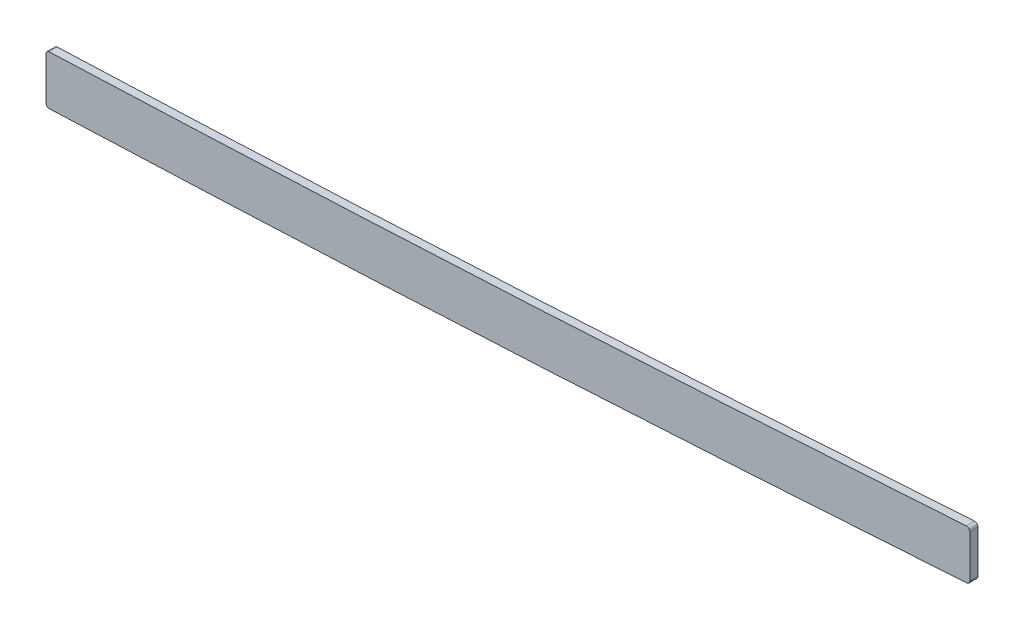
from build123d import *

# Parameters (mm, degrees)
BOSS_EXTRUDE1_DEPTH = 1.5875
FILLET1_R           = 1.27


with BuildPart() as part:
    # Sketch1 → Boss-Extrude1 (new, symmetric)
    with BuildSketch(Plane.XY):
        with BuildLine():
            Line((2311.4, -9.245652974), (2311.4, -28.310356345))
            add(Edge.make_bspline(
                [(2669.54, -9.569049356), (2615.393603553, -13.17073937), (2561.080658619, -16.536108081), (2506.205230446, -19.758621957), (2434.382223772, -23.29947809), (2362.559217098, -26.286274493), (2345.393069943, -26.972929947), (2328.342945407, -27.644579597), (2311.4, -28.310356345)],
                knots=[103.698913506, 103.698913506, 103.698913506, 103.698913506, 103.698913506, 103.698913506, 130.927896619, 130.927896619, 130.927896619, 139.270260279, 139.270260279, 139.270260279, 139.270260279, 139.270260279, 139.270260279], degree=5))
            Line((2669.54, -9.569049356), (2669.54, 9.5231025))
            add(Edge.make_bspline(
                [(2669.54, 9.5231025), (2667.126494524, 9.36235515), (2659.861586685, 8.880281494), (2635.666282302, 7.292469146), (2596.857665529, 4.826056853), (2545.729743039, 1.758344093), (2494.405305707, -1.098555235), (2451.533022267, -3.266573297), (2417.198316756, -4.86708361), (2391.457076919, -6.003589235), (2365.634736307, -7.086854581), (2341.015642019, -8.078542398), (2322.924133841, -8.79260451), (2313.562932275, -9.160652062), (2311.4, -9.245652974)],
                knots=[103.571582669, 103.571582669, 103.571582669, 103.571582669, 104.300777207, 105.766098403, 110.877392287, 115.98868617, 121.099980054, 126.211273938, 128.76692088, 131.322567822, 133.878214764, 136.433861706, 138.557690156, 139.196601892, 139.196601892, 139.196601892, 139.196601892], degree=3))
        make_face()
    extrude(amount=BOSS_EXTRUDE1_DEPTH, both=True)

    # Fillet1
    fillet1_edges = [part.edges().sort_by_distance(p)[0] for p in [
        (2669.54, 9.5231025, -0.79375),
        (2669.54, -9.569049356, -0.79375),
        (2311.4, -9.245652974, -0.79375),
        (2311.4, -28.310356345, -0.79375),
    ]]
    fillet(fillet1_edges, radius=FILLET1_R)


solid = part.part
